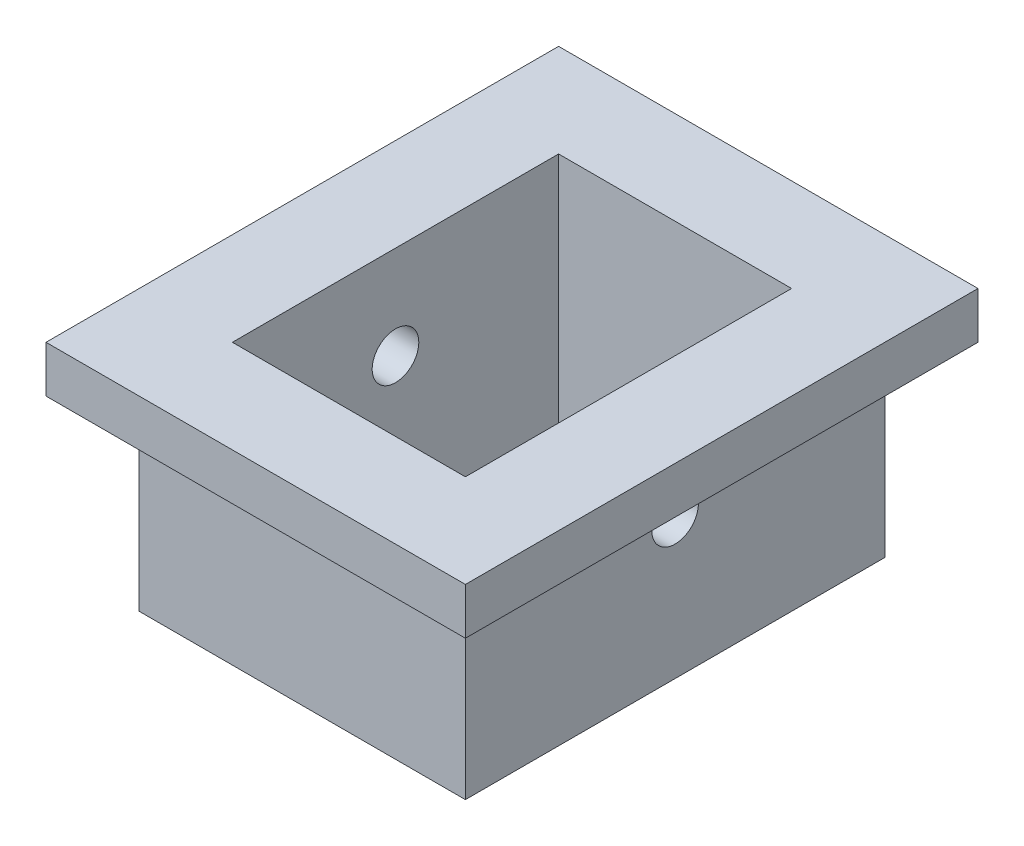
from build123d import *

# Parameters (mm, degrees)
SKETCH1_W               = 8.89
SKETCH1_H               = 11.43
SKETCH1_W_2             = 6.35
SKETCH1_H_2             = 8.89
BOSS_EXTRUDE1_DEPTH     = 6.35
SKETCH2_W               = 11.43
SKETCH2_H               = 13.97
SKETCH2_W_2             = 8.89
SKETCH2_H_2             = 11.43
BOSS_EXTRUDE2_DEPTH     = 1.27
CUT_EXTRUDE1_DEPTH      = 13.967066939
CUT_EXTRUDE1_DEPTH_BACK = 13.967066939
SKETCH3_R               = 0.635


with BuildPart() as part:
    # Sketch1 → Boss-Extrude1 (new body)
    with BuildSketch(Plane(origin=(0, 0, 0), x_dir=(1, 0, 0), z_dir=(0, 1, 0))):
        Rectangle(SKETCH1_W, SKETCH1_H)
        Rectangle(SKETCH1_W_2, SKETCH1_H_2, mode=Mode.SUBTRACT)
    extrude(amount=BOSS_EXTRUDE1_DEPTH)

    # Sketch2 → Boss-Extrude2 (add)
    with BuildSketch(Plane(origin=(0, 6.35, 0), x_dir=(1, 0, 0), z_dir=(0, 1, 0))):
        Rectangle(SKETCH2_W, SKETCH2_H)
        Rectangle(SKETCH2_W_2, SKETCH2_H_2, mode=Mode.SUBTRACT)
    extrude(amount=-BOSS_EXTRUDE2_DEPTH)

    # Sketch3 → Cut-Extrude1 (cut, two sides: drawn at the far end of the back side and taken through both)
    with BuildSketch(Plane.ZY.offset(-3.175).offset(-CUT_EXTRUDE1_DEPTH_BACK)):
        with Locations((0, 3.81)):
            Circle(SKETCH3_R)
    extrude(amount=CUT_EXTRUDE1_DEPTH + CUT_EXTRUDE1_DEPTH_BACK, mode=Mode.SUBTRACT)


solid = part.part
